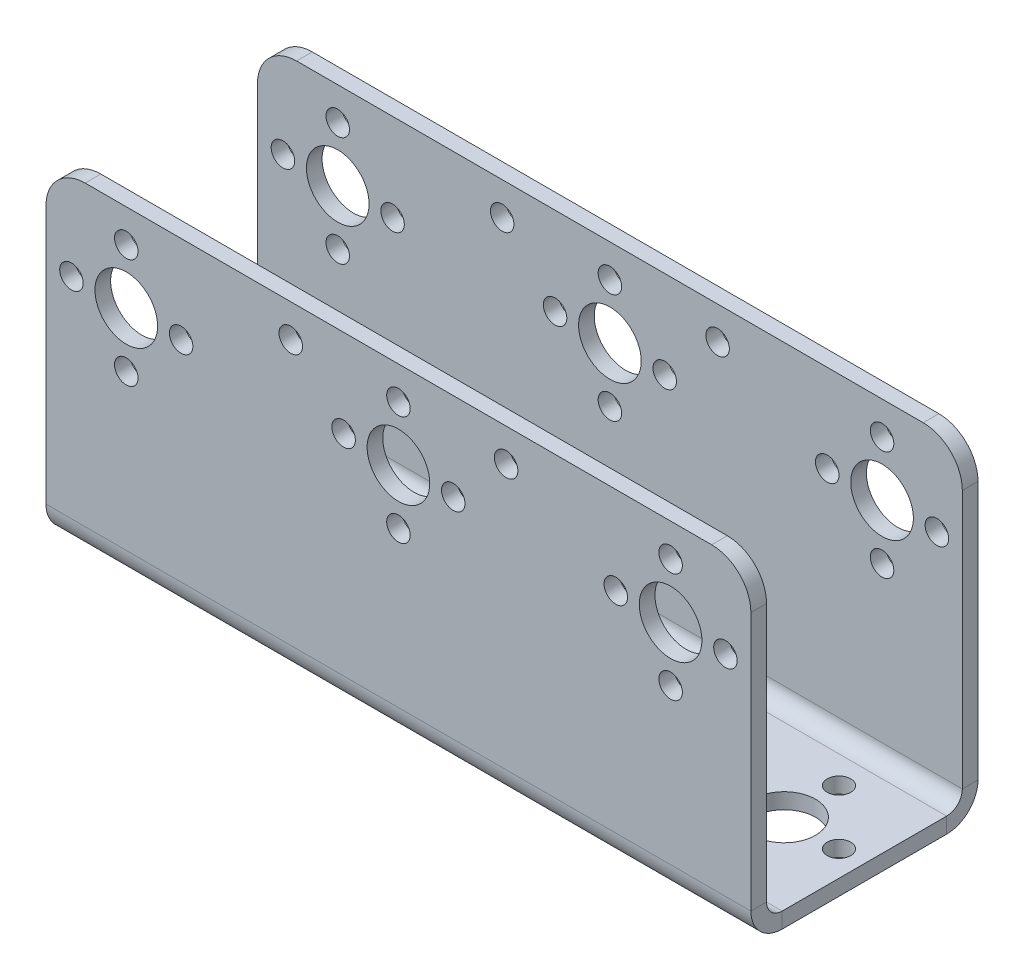
from build123d import *

# Parameters (mm, degrees)
BASE_FLANGE1_DEPTH           = 2
EDGE_FLANGE1_STRIP_W         = 12
EDGE_FLANGE1_STRIP_H         = 2
EDGE_FLANGE1_STRIP_CUT_DEPTH = 90
EDGE_FLANGE1_DEPTH           = 90
SKETCH11_R                   = 4
CUT_EXTRUDE1_DEPTH           = 69.044103345
M3X0_5_TAPPED_HOLE1_D        = 3
SKETCH14_R                   = 4
CUT_EXTRUDE2_DEPTH           = 67.828137786
M3X0_5_TAPPED_HOLE2_D        = 3


# Sheet-metal steps are written as plain solids
with BuildPart() as part:
    # Sketch1 → Base-Flange1 (new body)
    with BuildSketch(Plane.XY):
        with BuildLine():
            Line((-45, 0), (45, 0))
            Line((45, 0), (45, 37))
            ThreePointArc((45, 37), (43.535533906, 40.535533906), (40, 42))
            Line((40, 42), (-40, 42))
            ThreePointArc((-40, 42), (-43.535533906, 40.535533906), (-45, 37))
            Line((-45, 37), (-45, 0))
        make_face()
    extrude(amount=-BASE_FLANGE1_DEPTH)

    # Edge-Flange1 strip (across the edge) → Edge-Flange1 strip cut (cut)
    with BuildSketch(Plane(origin=(45, 0, -2), x_dir=(0, 1, 0), z_dir=(-1, 0, 0))):
        with Locations((-2, -1)):
            Rectangle(EDGE_FLANGE1_STRIP_W, EDGE_FLANGE1_STRIP_H)
    extrude(amount=EDGE_FLANGE1_STRIP_CUT_DEPTH, mode=Mode.SUBTRACT)

    # Edge-Flange1 section (across the edge) → Edge-Flange1 (add)
    with BuildSketch(Plane(origin=(45, 0, -2), x_dir=(0, 1, 0), z_dir=(-1, 0, 0))):
        with BuildLine():
            Line((0, 2), (0, 12.5))
            Line((0, 12.5), (2, 12.5))
            Line((2, 12.5), (2, 2))
            ThreePointArc((2, 2), (2.585786438, 0.585786438), (4, 0))
            Line((4, 0), (4, -2))
            ThreePointArc((4, -2), (1.171572875, -0.828427125), (0, 2))
        make_face()
    extrude(amount=EDGE_FLANGE1_DEPTH)

    # Mirror1: part across plane


with BuildPart() as part_1:
    add(part.part)
    add(part.part.mirror(Plane(origin=(45, 0, -14.5), x_dir=(1, 0, 0), z_dir=(0, 0, 1))))

    # Sketch11 → Cut-Extrude1 (cut, through all)
    with BuildSketch(Plane.XY):
        with Locations((-34.75, 30.8)):
            Circle(SKETCH11_R)
        with Locations((0, 30.8)):
            Circle(SKETCH11_R)
        with Locations((34.75, 30.8)):
            Circle(SKETCH11_R)
    extrude(amount=-CUT_EXTRUDE1_DEPTH, mode=Mode.SUBTRACT)

    # M3x0.5 Tapped Hole1 (through all)
    with Locations(Plane.XY):
        with Locations((-34.75, 37.8), (-34.75, 23.8), (-27.75, 30.8), (-41.75, 30.8), (0, 37.8), (0, 23.8), (-7, 30.8), (7, 30.8), (34.75, 37.8), (34.75, 23.8), (41.75, 30.8), (27.75, 30.8), (-13.75, 37.8), (13.75, 37.8)):
            Hole(M3X0_5_TAPPED_HOLE1_D / 2)

    # Sketch14 → Cut-Extrude2 (cut, through all)
    with BuildSketch(Plane(origin=(0, 2, 0), x_dir=(1, 0, 0), z_dir=(0, 1, 0))):
        with Locations(Location((-34.75, 14.5, 0), (0, 0, 270))):
            Circle(SKETCH14_R)
        with Locations(Location((0, 14.5, 0), (0, 0, 270))):
            Circle(SKETCH14_R)
        with Locations(Location((34.75, 14.5, 0), (0, 0, 270))):
            Circle(SKETCH14_R)
    extrude(amount=-CUT_EXTRUDE2_DEPTH, mode=Mode.SUBTRACT)

    # M3x0.5 Tapped Hole2 (through all)
    with Locations(Plane(origin=(0, 2, 0), x_dir=(1, 0, 0), z_dir=(0, 1, 0))):
        with Locations((-34.75, 21.5), (-34.75, 7.5), (-41.75, 14.5), (-27.75, 14.5), (0, 21.5), (0, 7.5), (-7, 14.5), (7, 14.5), (34.75, 21.5), (34.75, 7.5), (41.75, 14.5), (27.75, 14.5)):
            Hole(M3X0_5_TAPPED_HOLE2_D / 2)


solid = part_1.part
